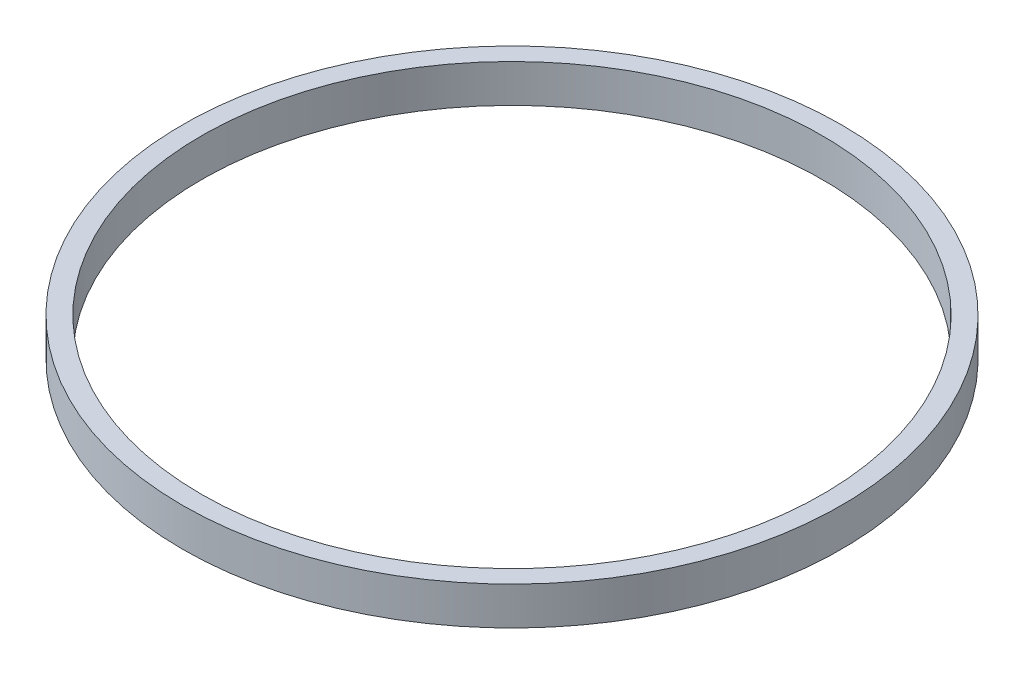
from build123d import *

# Parameters (mm, degrees)
SKETCH_1_R      = 26
SKETCH_1_R_2    = 24.5
EXTRUDE_1_DEPTH = 3


with BuildPart() as part:
    # Эскиз1 → Бобышка-Вытянуть1 (new body)
    with BuildSketch(Plane(origin=(0, 0, 0), x_dir=(1, 0, 0), z_dir=(0, 1, 0))):
        Circle(SKETCH_1_R)
        Circle(SKETCH_1_R_2, mode=Mode.SUBTRACT)
    extrude(amount=EXTRUDE_1_DEPTH)


solid = part.part
